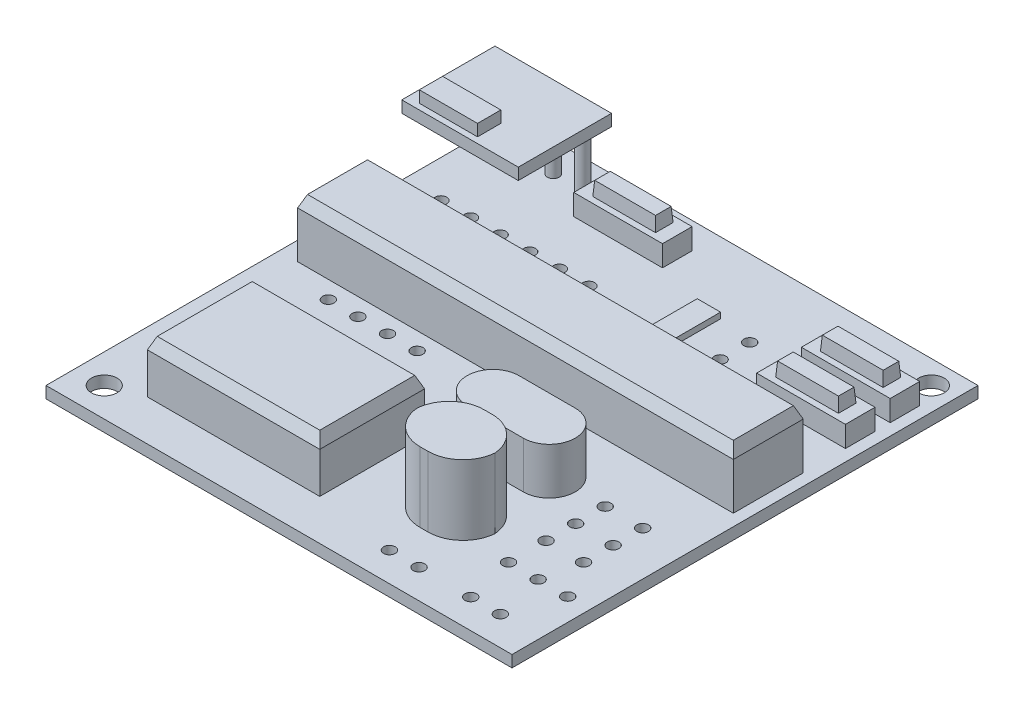
from build123d import *
from OCP.BRepFilletAPI import BRepFilletAPI_MakeChamfer

# Parameters (mm, degrees)
SKETCH1_W                    = 40
SKETCH1_H                    = 40
BOSS_EXTRUDE1_DEPTH          = 1
SKETCH2_W                    = 37.4
SKETCH2_H                    = 6
SKETCH2_W_2                  = 14.8
SKETCH2_H_2                  = 9
SKETCH2_W_3                  = 7.62
SKETCH2_H_3                  = 2.54
SKETCH2_W_4                  = 6.7
SKETCH2_H_4                  = 5.5
BOSS_EXTRUDE2_DEPTH          = 10
SKETCH3_W                    = 44.444208302
SKETCH3_H                    = 24.405132015
CUT_EXTRUDE1_DEPTH           = 5
SKETCH4_W                    = 37.986083978
SKETCH4_H                    = 13.538017351
CUT_EXTRUDE2_DEPTH           = 2
SKETCH5_W                    = 7.62
SKETCH5_H                    = 2.54
SKETCH5_W_2                  = 5.22
SKETCH5_H_2                  = 1.34
CUT_EXTRUDE3_DEPTH           = 1.2
CUT_EXTRUDE3_DRAFT           = -4
CUT_EXTRUDE3_PROFILE_2_DEPTH = 1.2
CUT_EXTRUDE3_PROFILE_2_DRAFT = -4
CUT_EXTRUDE3_PROFILE_3_DEPTH = 1.2
CUT_EXTRUDE3_PROFILE_3_DRAFT = -4
SKETCH6_W                    = 43.509309309
SKETCH6_H                    = 14.65684545
SKETCH6_W_2                  = 6.282444341
SKETCH6_H_2                  = 1.811548849
SKETCH6_W_3                  = 6.146239586
SKETCH6_H_3                  = 1.957943358
CUT_EXTRUDE4_DEPTH           = 1.2
SKETCH7_W                    = 37.4
SKETCH7_H                    = 6
CUT_EXTRUDE5_DEPTH           = 5
CHAMFER1_SIZE                = 1
CHAMFER1_SIZE2               = 0.424474816
SKETCH8_W                    = 14.8
SKETCH8_H                    = 9
CUT_EXTRUDE6_DEPTH           = 5.5
CHAMFER2_SIZE                = 1
CHAMFER2_SIZE2               = 0.424474816
SKETCH9_W                    = 6.7
SKETCH9_H                    = 5.5
CUT_EXTRUDE7_DEPTH           = 4
FILLET1_R                    = 3
SKETCH10_R                   = 1.1
CUT_EXTRUDE8_DEPTH           = 4
SKETCH11_R                   = 0.5
CUT_EXTRUDE10_DEPTH          = 4
SKETCH12_R                   = 0.5
BOSS_EXTRUDE3_DEPTH          = 5
SKETCH13_W                   = 10
SKETCH13_H                   = 8
BOSS_EXTRUDE4_DEPTH          = 1
SKETCH14_W                   = 5
SKETCH14_H                   = 2
BOSS_EXTRUDE5_DEPTH          = 1
BOSS_EXTRUDE6_DEPTH          = 4
SKETCH16_W                   = 2
SKETCH16_H                   = 4
BOSS_EXTRUDE7_DEPTH          = 0.5


with BuildPart() as part:
    # Sketch1 → Boss-Extrude1 (new body)
    with BuildSketch(Plane(origin=(0, 0, 0), x_dir=(1, 0, 0), z_dir=(0, 1, 0))):
        with Locations((-0.714285714, -2.5)):
            Rectangle(SKETCH1_W, SKETCH1_H)
    extrude(amount=BOSS_EXTRUDE1_DEPTH)

    # Sketch2 → Boss-Extrude2 (add)
    with BuildSketch(Plane(origin=(0, 1, 0), x_dir=(1, 0, 0), z_dir=(0, 1, 0))):
        with Locations((-0.414285714, 0.5)):
            Rectangle(SKETCH2_W, SKETCH2_H)
        with Locations((-8.114285714, -14.5)):
            Rectangle(SKETCH2_W_2, SKETCH2_H_2)
        with Locations((-6.804285714, 13.97)):
            Rectangle(SKETCH2_W_3, SKETCH2_H_3)
        with Locations((14.475714286, 12.23)):
            Rectangle(SKETCH2_W_3, SKETCH2_H_3)
        with Locations((14.475714286, 8.39)):
            Rectangle(SKETCH2_W_3, SKETCH2_H_3)
        with Locations((6.235714286, -14.25)):
            Rectangle(SKETCH2_W_4, SKETCH2_H_4)
    extrude(amount=BOSS_EXTRUDE2_DEPTH)

    # Sketch3 → Cut-Extrude1 (cut)
    with BuildSketch(Plane(origin=(0, 11, 0), x_dir=(1, 0, 0), z_dir=(0, 1, 0))):
        with Locations((0.671142181, 17.607012743)):
            Rectangle(SKETCH3_W, SKETCH3_H)
    extrude(amount=-CUT_EXTRUDE1_DEPTH, mode=Mode.SUBTRACT)

    # Sketch4 → Cut-Extrude2 (cut)
    with BuildSketch(Plane(origin=(0, 6, 0), x_dir=(1, 0, 0), z_dir=(0, 1, 0))):
        with Locations((1.316416888, 12.272365991)):
            Rectangle(SKETCH4_W, SKETCH4_H)
    extrude(amount=-CUT_EXTRUDE2_DEPTH, mode=Mode.SUBTRACT)


with BuildPart() as cut_extrude3_tool:
    # Sketch5 → Cut-Extrude3 (with draft: the straight prism first)
    with BuildSketch(Plane(origin=(0, 4, 0), x_dir=(1, 0, 0), z_dir=(0, 1, 0))):
        with Locations((-6.804285714, 13.97)):
            Rectangle(SKETCH5_W, SKETCH5_H)
        with Locations((-6.804285714, 13.97)):
            Rectangle(SKETCH5_W_2, SKETCH5_H_2, mode=Mode.SUBTRACT)
    extrude(amount=-CUT_EXTRUDE3_DEPTH)
    # Cut-Extrude3: the draft: its side faces are tilted about the plane it starts from
    cut_extrude3_sides = [cut_extrude3_tool.faces().sort_by_distance(p)[0] for p in [
        (-10.614285714, 3.4, -13.97),
        (-6.804285714, 3.4, -12.7),
        (-2.994285714, 3.4, -13.97),
        (-6.804285714, 3.4, -15.24),
        (-6.804285714, 3.4, -14.64),
        (-4.194285714, 3.4, -13.97),
        (-6.804285714, 3.4, -13.3),
        (-9.414285714, 3.4, -13.97),
    ]]
    draft(cut_extrude3_sides, Plane(origin=(0, 4, 0), x_dir=(1, 0, 0), z_dir=(0, 1, 0)), CUT_EXTRUDE3_DRAFT)


with BuildPart() as part_1:
    add(part.part)

    # Cut-Extrude3: cut by cut_extrude3_tool
    add(cut_extrude3_tool.part, mode=Mode.SUBTRACT)


with BuildPart() as cut_extrude3_profile_2_tool:
    # Sketch5 → Cut-Extrude3 profile 2 (with draft: the straight prism first)
    with BuildSketch(Plane(origin=(0, 4, 0), x_dir=(1, 0, 0), z_dir=(0, 1, 0))):
        with Locations((14.475714286, 12.23)):
            Rectangle(SKETCH5_W, SKETCH5_H)
        with Locations((14.475714286, 12.23)):
            Rectangle(SKETCH5_W_2, SKETCH5_H_2, mode=Mode.SUBTRACT)
    extrude(amount=-CUT_EXTRUDE3_PROFILE_2_DEPTH)
    # Cut-Extrude3 profile 2: the draft: its side faces are tilted about the plane it starts from
    cut_extrude3_profile_2_sides = [cut_extrude3_profile_2_tool.faces().sort_by_distance(p)[0] for p in [
        (10.665714286, 3.4, -12.23),
        (14.475714286, 3.4, -10.96),
        (18.285714286, 3.4, -12.23),
        (14.475714286, 3.4, -13.5),
        (14.475714286, 3.4, -12.9),
        (17.085714286, 3.4, -12.23),
        (14.475714286, 3.4, -11.56),
        (11.865714286, 3.4, -12.23),
    ]]
    draft(cut_extrude3_profile_2_sides, Plane(origin=(0, 4, 0), x_dir=(1, 0, 0), z_dir=(0, 1, 0)), CUT_EXTRUDE3_PROFILE_2_DRAFT)


with BuildPart() as part_2:
    add(part_1.part)

    # Cut-Extrude3 profile 2: cut by cut_extrude3_profile_2_tool
    add(cut_extrude3_profile_2_tool.part, mode=Mode.SUBTRACT)


with BuildPart() as cut_extrude3_profile_3_tool:
    # Sketch5 → Cut-Extrude3 profile 3 (with draft: the straight prism first)
    with BuildSketch(Plane(origin=(0, 4, 0), x_dir=(1, 0, 0), z_dir=(0, 1, 0))):
        with Locations((14.475714286, 8.39)):
            Rectangle(SKETCH5_W, SKETCH5_H)
        with Locations((14.475714286, 8.39)):
            Rectangle(SKETCH5_W_2, SKETCH5_H_2, mode=Mode.SUBTRACT)
    extrude(amount=-CUT_EXTRUDE3_PROFILE_3_DEPTH)
    # Cut-Extrude3 profile 3: the draft: its side faces are tilted about the plane it starts from
    cut_extrude3_profile_3_sides = [cut_extrude3_profile_3_tool.faces().sort_by_distance(p)[0] for p in [
        (10.665714286, 3.4, -8.39),
        (14.475714286, 3.4, -7.12),
        (18.285714286, 3.4, -8.39),
        (14.475714286, 3.4, -9.66),
        (14.475714286, 3.4, -9.06),
        (17.085714286, 3.4, -8.39),
        (14.475714286, 3.4, -7.72),
        (11.865714286, 3.4, -8.39),
    ]]
    draft(cut_extrude3_profile_3_sides, Plane(origin=(0, 4, 0), x_dir=(1, 0, 0), z_dir=(0, 1, 0)), CUT_EXTRUDE3_PROFILE_3_DRAFT)


with BuildPart() as part_3:
    add(part_2.part)

    # Cut-Extrude3 profile 3: cut by cut_extrude3_profile_3_tool
    add(cut_extrude3_profile_3_tool.part, mode=Mode.SUBTRACT)

    # Sketch6 → Cut-Extrude4 (cut)
    with BuildSketch(Plane(origin=(0, 4, 0), x_dir=(1, 0, 0), z_dir=(0, 1, 0))):
        with Locations((1.46415277, 11.874760487)):
            Rectangle(SKETCH6_W, SKETCH6_H)
        Polygon((-10.258568455, 13.117709551), (-10.258568455, 14.988111357), (-3.391887854, 14.988111357), (-3.391887854, 12.963977896), align=None, mode=Mode.SUBTRACT)
        with Locations((14.407855281, 12.211935127)):
            Rectangle(SKETCH6_W_2, SKETCH6_H_2, mode=Mode.SUBTRACT)
        with Locations((14.475957658, 8.403296853)):
            Rectangle(SKETCH6_W_3, SKETCH6_H_3, mode=Mode.SUBTRACT)
    extrude(amount=-CUT_EXTRUDE4_DEPTH, mode=Mode.SUBTRACT)

    # Sketch7 → Cut-Extrude5 (cut)
    with BuildSketch(Plane(origin=(0, 11, 0), x_dir=(1, 0, 0), z_dir=(0, 1, 0))):
        with Locations((-0.414285714, 0.5)):
            Rectangle(SKETCH7_W, SKETCH7_H)
    extrude(amount=-CUT_EXTRUDE5_DEPTH, mode=Mode.SUBTRACT)

    # Chamfer1: one chamfer whose edges measure the first distance from different faces: ONE call of the kernel's chamfer builder (chamfer() names one face for all edges)
    chamfer1_edges_1 = [part_3.edges().sort_by_distance(p)[0] for p in [
        (-19.114285714, 6, -0.5),
    ]]
    chamfer1_side_1 = [part_3.faces().sort_by_distance(p)[0] for p in [
        (-19.114285714, 3.5, -0.5),
    ]]
    chamfer1_edges_2 = [part_3.edges().sort_by_distance(p)[0] for p in [
        (-0.414285714, 6, -3.5),
    ]]
    chamfer1_side_2 = [part_3.faces().sort_by_distance(p)[0] for p in [
        (-0.414285714, 3.5, -3.5),
    ]]
    chamfer1_edges_3 = [part_3.edges().sort_by_distance(p)[0] for p in [
        (18.285714286, 6, -0.5),
    ]]
    chamfer1_side_3 = [part_3.faces().sort_by_distance(p)[0] for p in [
        (18.285714286, 3.5, -0.5),
    ]]
    chamfer1_edges_4 = [part_3.edges().sort_by_distance(p)[0] for p in [
        (-0.414285714, 6, 2.5),
    ]]
    chamfer1_side_4 = [part_3.faces().sort_by_distance(p)[0] for p in [
        (-0.414285714, 3.5, 2.5),
    ]]
    chamfer1 = BRepFilletAPI_MakeChamfer(part_3.part.solid().wrapped)
    for e in chamfer1_edges_1:
        chamfer1.Add(CHAMFER1_SIZE, CHAMFER1_SIZE2, e.wrapped, chamfer1_side_1[0].wrapped)  # the first distance lies on this face
    for e in chamfer1_edges_2:
        chamfer1.Add(CHAMFER1_SIZE, CHAMFER1_SIZE2, e.wrapped, chamfer1_side_2[0].wrapped)  # the first distance lies on this face
    for e in chamfer1_edges_3:
        chamfer1.Add(CHAMFER1_SIZE, CHAMFER1_SIZE2, e.wrapped, chamfer1_side_3[0].wrapped)  # the first distance lies on this face
    for e in chamfer1_edges_4:
        chamfer1.Add(CHAMFER1_SIZE, CHAMFER1_SIZE2, e.wrapped, chamfer1_side_4[0].wrapped)  # the first distance lies on this face
    add(Compound.cast(chamfer1.Shape()), mode=Mode.REPLACE)

    # Sketch8 → Cut-Extrude6 (cut)
    with BuildSketch(Plane(origin=(0, 11, 0), x_dir=(1, 0, 0), z_dir=(0, 1, 0))):
        with Locations((-8.114285714, -14.5)):
            Rectangle(SKETCH8_W, SKETCH8_H)
    extrude(amount=-CUT_EXTRUDE6_DEPTH, mode=Mode.SUBTRACT)

    # Chamfer2: one chamfer whose edges measure the first distance from different faces: ONE call of the kernel's chamfer builder (chamfer() names one face for all edges)
    chamfer2_edges_1 = [part_3.edges().sort_by_distance(p)[0] for p in [
        (-15.514285714, 5.5, 14.5),
    ]]
    chamfer2_side_1 = [part_3.faces().sort_by_distance(p)[0] for p in [
        (-15.514285714, 3.25, 14.5),
    ]]
    chamfer2_edges_2 = [part_3.edges().sort_by_distance(p)[0] for p in [
        (-8.114285714, 5.5, 10),
    ]]
    chamfer2_side_2 = [part_3.faces().sort_by_distance(p)[0] for p in [
        (-8.114285714, 3.25, 10),
    ]]
    chamfer2_edges_3 = [part_3.edges().sort_by_distance(p)[0] for p in [
        (-0.714285714, 5.5, 14.5),
    ]]
    chamfer2_side_3 = [part_3.faces().sort_by_distance(p)[0] for p in [
        (-0.714285714, 3.25, 14.5),
    ]]
    chamfer2_edges_4 = [part_3.edges().sort_by_distance(p)[0] for p in [
        (-8.114285714, 5.5, 19),
    ]]
    chamfer2_side_4 = [part_3.faces().sort_by_distance(p)[0] for p in [
        (-8.114285714, 3.25, 19),
    ]]
    chamfer2 = BRepFilletAPI_MakeChamfer(part_3.part.solid().wrapped)
    for e in chamfer2_edges_1:
        chamfer2.Add(CHAMFER2_SIZE, CHAMFER2_SIZE2, e.wrapped, chamfer2_side_1[0].wrapped)  # the first distance lies on this face
    for e in chamfer2_edges_2:
        chamfer2.Add(CHAMFER2_SIZE, CHAMFER2_SIZE2, e.wrapped, chamfer2_side_2[0].wrapped)  # the first distance lies on this face
    for e in chamfer2_edges_3:
        chamfer2.Add(CHAMFER2_SIZE, CHAMFER2_SIZE2, e.wrapped, chamfer2_side_3[0].wrapped)  # the first distance lies on this face
    for e in chamfer2_edges_4:
        chamfer2.Add(CHAMFER2_SIZE, CHAMFER2_SIZE2, e.wrapped, chamfer2_side_4[0].wrapped)  # the first distance lies on this face
    add(Compound.cast(chamfer2.Shape()), mode=Mode.REPLACE)

    # Sketch9 → Cut-Extrude7 (cut)
    with BuildSketch(Plane(origin=(0, 11, 0), x_dir=(1, 0, 0), z_dir=(0, 1, 0))):
        with Locations((6.235714286, -14.25)):
            Rectangle(SKETCH9_W, SKETCH9_H)
    extrude(amount=-CUT_EXTRUDE7_DEPTH, mode=Mode.SUBTRACT)

    # Fillet1
    # the kernel refuses this fillet: 3 mm, written as the material it takes off along each edge
    with BuildSketch(Plane(origin=(9.585714286, 1, 11.5), x_dir=(-1, 0, 0), z_dir=(0, 1, 0)), Plane(origin=(9.585714286, 1, 17), x_dir=(0, 0, -1), z_dir=(0, 1, 0)), Plane(origin=(2.885714286, 1, 17), x_dir=(1, 0, 0), z_dir=(0, 1, 0))) as fillet1_piece_1:
        with BuildLine():
            CenterArc((FILLET1_R, FILLET1_R), FILLET1_R, 180, 90)
            Line((0, FILLET1_R), (0, 0))
            Line((0, 0), (FILLET1_R, 0))
        make_face()
    extrude(amount=13.5, mode=Mode.SUBTRACT)
    with BuildSketch(Plane(origin=(2.885714286, 1, 11.5), x_dir=(1, 0, 0), z_dir=(0, 1, 0))) as fillet1_piece_2:
        with BuildLine():
            CenterArc((FILLET1_R, -FILLET1_R), FILLET1_R, 90, 90)
            Line((0, -FILLET1_R), (0, 0))
            Line((0, 0), (FILLET1_R, 0))
        make_face()
    extrude(amount=13.5, mode=Mode.SUBTRACT)

    # Sketch10 → Cut-Extrude8 (cut)
    with BuildSketch(Plane(origin=(0, 1, 0), x_dir=(1, 0, 0), z_dir=(0, 1, 0))):
        with Locations(Location((-18.214285714, -20, 0), (0, 0, 270))):
            Circle(SKETCH10_R)
        with Locations(Location((17.285714286, 15.5, 0), (0, 0, 270))):
            Circle(SKETCH10_R)
    extrude(amount=-CUT_EXTRUDE8_DEPTH, mode=Mode.SUBTRACT)

    # Sketch11 → Cut-Extrude10 (cut)
    with BuildSketch(Plane(origin=(0, 1, 0), x_dir=(1, 0, 0), z_dir=(0, 1, 0))):
        with Locations(Location((-17.514285714, 8.2, 0), (0, 0, 270))):
            Circle(SKETCH11_R)
        with Locations(Location((-14.974285714, 8.2, 0), (0, 0, 270))):
            Circle(SKETCH11_R)
        with Locations(Location((-9.894285714, 8.2, 0), (0, 0, 270))):
            Circle(SKETCH11_R)
        with Locations(Location((-7.354285714, 8.2, 0), (0, 0, 270))):
            Circle(SKETCH11_R)
        with Locations(Location((-4.814285714, 8.2, 0), (0, 0, 270))):
            Circle(SKETCH11_R)
        with Locations(Location((-12.434285714, 8.2, 0), (0, 0, 270))):
            Circle(SKETCH11_R)
        with Locations(Location((-14.974285714, -4.00478655, 0), (0, 0, 270))):
            Circle(SKETCH11_R)
        with Locations(Location((-12.434285714, -4.00478655, 0), (0, 0, 270))):
            Circle(SKETCH11_R)
        with Locations(Location((-9.894285714, -4.00478655, 0), (0, 0, 270))):
            Circle(SKETCH11_R)
        with Locations(Location((-7.354285714, -4.00478655, 0), (0, 0, 270))):
            Circle(SKETCH11_R)
        with Locations(Location((6.285714286, 10.9, 0), (0, 0, 270))):
            Circle(SKETCH11_R)
        with Locations(Location((6.285714286, 8.36, 0), (0, 0, 270))):
            Circle(SKETCH11_R)
        with Locations(Location((12.285714286, -7.5, 0), (0, 0, 270))):
            Circle(SKETCH11_R)
        with Locations(Location((12.285714286, -10.04, 0), (0, 0, 270))):
            Circle(SKETCH11_R)
        with Locations(Location((12.285714286, -12.58, 0), (0, 0, 270))):
            Circle(SKETCH11_R)
        with Locations(Location((15.505714286, -7.5, 0), (0, 0, 270))):
            Circle(SKETCH11_R)
        with Locations(Location((15.505714286, -10.04, 0), (0, 0, 270))):
            Circle(SKETCH11_R)
        with Locations(Location((15.505714286, -12.58, 0), (0, 0, 270))):
            Circle(SKETCH11_R)
        with Locations(Location((12.285714286, -15.8, 0), (0, 0, 270))):
            Circle(SKETCH11_R)
        with Locations(Location((14.825714286, -15.8, 0), (0, 0, 270))):
            Circle(SKETCH11_R)
        with Locations(Location((17.365714286, -15.8, 0), (0, 0, 270))):
            Circle(SKETCH11_R)
        with Locations(Location((15.785714286, -20, 0), (0, 0, 270))):
            Circle(SKETCH11_R)
        with Locations(Location((13.245714286, -20, 0), (0, 0, 270))):
            Circle(SKETCH11_R)
        with Locations(Location((8.805714286, -20, 0), (0, 0, 270))):
            Circle(SKETCH11_R)
        with Locations(Location((6.265714286, -20, 0), (0, 0, 270))):
            Circle(SKETCH11_R)
    extrude(amount=-CUT_EXTRUDE10_DEPTH, mode=Mode.SUBTRACT)

    # Sketch12 → Boss-Extrude3 (add)
    with BuildSketch(Plane(origin=(0, 1, 0), x_dir=(1, 0, 0), z_dir=(0, 1, 0))):
        with Locations(Location((-17.214285714, 15, 0), (0, 0, 270))):
            Circle(SKETCH12_R)
        with Locations(Location((-14.674285714, 15, 0), (0, 0, 270))):
            Circle(SKETCH12_R)
        with Locations(Location((-12.134285714, 15, 0), (0, 0, 270))):
            Circle(SKETCH12_R)
    extrude(amount=BOSS_EXTRUDE3_DEPTH)

    # Sketch13 → Boss-Extrude4 (add)
    with BuildSketch(Plane(origin=(0, 6, 0), x_dir=(1, 0, 0), z_dir=(0, 1, 0))):
        with Locations((-15.674285714, 12)):
            Rectangle(SKETCH13_W, SKETCH13_H)
    extrude(amount=BOSS_EXTRUDE4_DEPTH)

    # Sketch14 → Boss-Extrude5 (add)
    with BuildSketch(Plane(origin=(0, 7, 0), x_dir=(1, 0, 0), z_dir=(0, 1, 0))):
        with Locations((-17.174285714, 9.5)):
            Rectangle(SKETCH14_W, SKETCH14_H)
    extrude(amount=BOSS_EXTRUDE5_DEPTH)

    # Sketch15 → Boss-Extrude6 (add)
    with BuildSketch(Plane(origin=(0, 1, 0), x_dir=(1, 0, 0), z_dir=(0, 1, 0))):
        with BuildLine():
            Line((2.855714286, -5.47), (7.685714286, -5.47))
            ThreePointArc((7.685714286, -5.47), (9.915714286, -7.7), (7.685714286, -9.93))
            Line((7.685714286, -9.93), (2.855714286, -9.93))
            ThreePointArc((2.855714286, -9.93), (0.625714286, -7.7), (2.855714286, -5.47))
        make_face()
    extrude(amount=BOSS_EXTRUDE6_DEPTH)

    # Sketch16 → Boss-Extrude7 (add)
    with BuildSketch(Plane(origin=(0, 1, 0), x_dir=(1, 0, 0), z_dir=(0, 1, 0))):
        with Locations((2.285714286, 9.4)):
            Rectangle(SKETCH16_W, SKETCH16_H)
        with Locations((-17.564285714, -13.5)):
            Rectangle(SKETCH16_W, SKETCH16_H)
    extrude(amount=BOSS_EXTRUDE7_DEPTH)


solid = part_3.part
